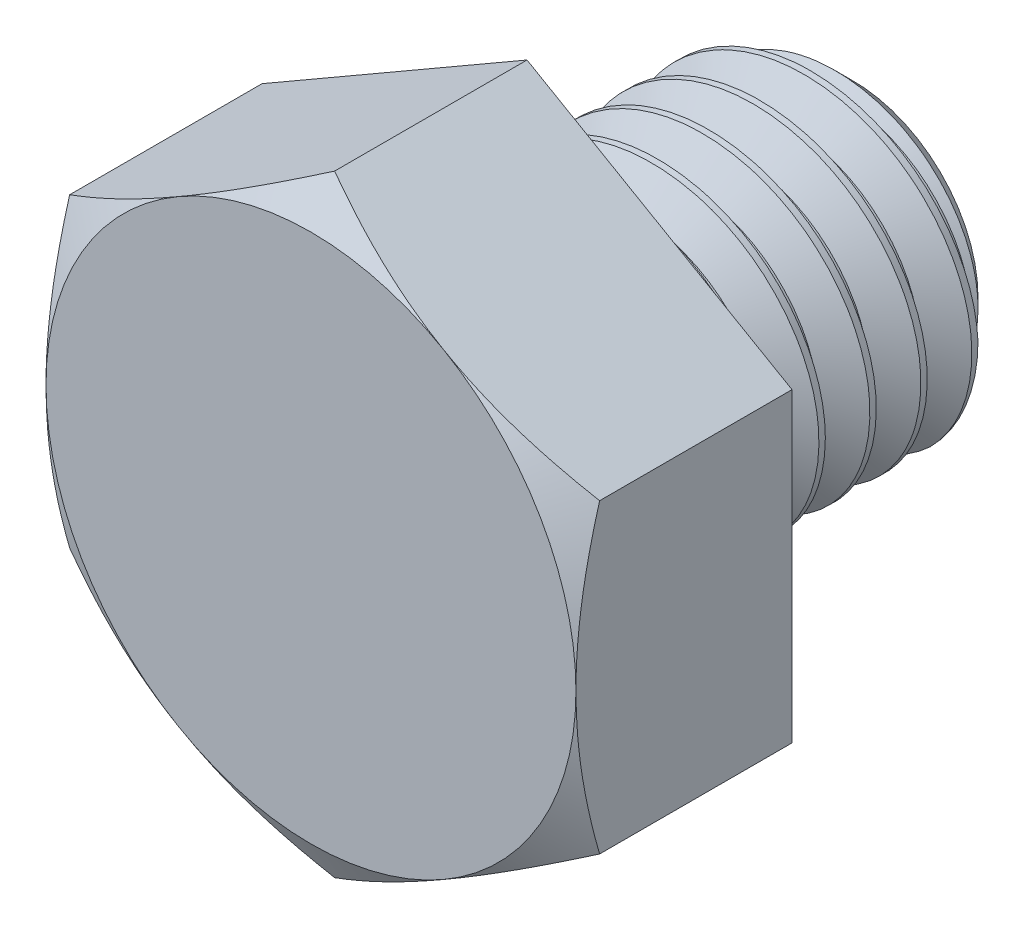
from build123d import *

# Parameters (mm, degrees)
BOSS_EXTRUDE1_DEPTH = 5.3
SKETCH4_OUTSIDE_W   = 80.74
SKETCH4_OUTSIDE_H   = 82.752
SKETCH4_OUTSIDE_R   = 6.5
CUT_EXTRUDE1_DEPTH  = 17.597389353
CUT_EXTRUDE1_DRAFT  = -60
CUT_SWEEP1_PITCH    = 1.25
CUT_SWEEP1_TO       = 8
SKETCH8_R           = 4
BOSS_EXTRUDE2_DEPTH = 8
BOSS_EXTRUDE2_TAPER = 20


with BuildPart() as part:
    # Sketch2 → Revolve1 (revolve)
    with BuildSketch(Plane(origin=(0, 0, 0), x_dir=(0, 0, -1), z_dir=(1, 0, 0)), mode=Mode.PRIVATE) as revolve1_sk:
        Polygon((-6.65, 6.5), (-6.65, 0), (6.65, 0), (6.65, 3.0625), (5.7125, 4), (-1.35, 4), (-1.35, 6.5), align=None)
    revolve(revolve1_sk.sketch.rotate(Axis((0, 0, 6.65), (0, 0, -1)), 90), axis=Axis((0, 0, 6.65), (0, 0, -1)))

    # Sketch3 → Boss-Extrude1 (add)
    with BuildSketch(Plane.XY.offset(6.65)):
        Polygon((0, 7.505553499), (-6.5, 3.75277675), (-6.5, -3.75277675), (0, -7.505553499), (6.5, -3.75277675), (6.5, 3.75277675), align=None)
    extrude(amount=-BOSS_EXTRUDE1_DEPTH)


with BuildPart() as cut_extrude1_tool:
    # Sketch4 outside → Cut-Extrude1 (with draft: the straight prism first)
    with BuildSketch(Plane.XY.offset(6.65)):
        Rectangle(SKETCH4_OUTSIDE_W, SKETCH4_OUTSIDE_H)
        Circle(SKETCH4_OUTSIDE_R, mode=Mode.SUBTRACT)
    extrude(amount=-CUT_EXTRUDE1_DEPTH)
    # Cut-Extrude1: the draft: its side faces are tilted about the plane it starts from
    cut_extrude1_sides = [cut_extrude1_tool.faces().sort_by_distance(p)[0] for p in [
        (0, -41.376, -2.148694676),
        (40.37, 0, -2.148694676),
        (0, 41.376, -2.148694676),
        (-40.37, 0, -2.148694676),
        (-6.5, 0, -2.148694676),
    ]]
    draft(cut_extrude1_sides, Plane.XY.offset(6.65), CUT_EXTRUDE1_DRAFT)


with BuildPart() as part_1:
    add(part.part)

    # Cut-Extrude1: cut by cut_extrude1_tool
    add(cut_extrude1_tool.part, mode=Mode.SUBTRACT)


with BuildPart() as body_2:
    # Split1: read off the stored shape, not the designer's step
    # Split1: the piece on the far side of the plane
    add(part_1.part)
    split(bisect_by=Plane.XY.offset(1.35), keep=Keep.BOTTOM)

    # Cut-Sweep1: arcs per turn and ends read off the stored shape
    # Cut-Sweep1: the profile of Sketch7 screwed along a right-hand helix through 7.4 turns, 8 arcs to a turn; built about Z, then put on its axis
    cut_sweep1_z = Axis((0, 0, 0), (0, 0, 1))
    cut_sweep1_corners = [(4.067658235, 0, 0.0390625), (3.188101184, 0, -0.46875), (3.188101184, 0, -0.625), (4.067658235, 0, -1.1328125)]
    with BuildLine(mode=Mode.PRIVATE) as cut_sweep1_profile:
        Line(cut_sweep1_corners[0], cut_sweep1_corners[1])
        Line(cut_sweep1_corners[1], cut_sweep1_corners[2])
        Line(cut_sweep1_corners[2], cut_sweep1_corners[3])
        Line(cut_sweep1_corners[3], cut_sweep1_corners[0])
    cut_sweep1_cap = Face(cut_sweep1_profile.wire())
    cut_sweep1_turn_angles = [0, 22.5, 45, 67.5, 90, 112.5, 135, 157.5, 180, 202.5, 225, 247.5, 270, 292.5, 315, 337.5, 360]
    cut_sweep1_turn_weights = [1, 0.9238795325112867, 1, 0.9238795325112867, 1, 0.9238795325112867, 1, 0.9238795325112867, 1, 0.9238795325112867, 1, 0.9238795325112867, 1, 0.9238795325112867, 1, 0.9238795325112867, 1]
    cut_sweep1_turn_rails = [Edge.make_bspline([Vector(p[0], p[1], 0).rotate(cut_sweep1_z, cut_sweep1_turn_angles[k]) / cut_sweep1_turn_weights[k] + Vector(0, 0, p[2] + CUT_SWEEP1_PITCH * cut_sweep1_turn_angles[k] / 360) for k in range(17)], [0, 0, 0, 1, 1, 2, 2, 3, 3, 4, 4, 5, 5, 6, 6, 7, 7, 8, 8, 8], 2, cut_sweep1_turn_weights) for p in cut_sweep1_corners]
    cut_sweep1_turn_sides = [Face.make_surface_from_curves(cut_sweep1_turn_rails[p[0]], cut_sweep1_turn_rails[p[1]]) for p in [(0, 1), (1, 2), (2, 3), (3, 0)]]
    cut_sweep1_last_angles = [2520, 2542.5, 2565, 2587.5, 2610, 2632.5, 2655, 2659.5, 2664]
    cut_sweep1_last_weights = [1, 0.9238795325112867, 1, 0.9238795325112867, 1, 0.9238795325112867, 1, 0.9969173337331242, 1]
    cut_sweep1_last_rails = [Edge.make_bspline([Vector(p[0], p[1], 0).rotate(cut_sweep1_z, cut_sweep1_last_angles[k]) / cut_sweep1_last_weights[k] + Vector(0, 0, p[2] + CUT_SWEEP1_PITCH * cut_sweep1_last_angles[k] / 360) for k in range(9)], [0, 0, 0, 1, 1, 2, 2, 3, 3, 4, 4, 4], 2, cut_sweep1_last_weights) for p in cut_sweep1_corners]
    cut_sweep1_last_sides = [Face.make_surface_from_curves(cut_sweep1_last_rails[p[0]], cut_sweep1_last_rails[p[1]]) for p in [(0, 1), (1, 2), (2, 3), (3, 0)]]
    cut_sweep1 = Plane(origin=(0, 0, -6.65), x_dir=(0, 1, 0), z_dir=(0, 0, 1)) * split(Solid(Shell([*[p.moved(Location((0, 0, CUT_SWEEP1_PITCH * i))) for i in range(7) for p in cut_sweep1_turn_sides], *cut_sweep1_last_sides, cut_sweep1_cap, cut_sweep1_cap.rotate(cut_sweep1_z, 2664).moved(Location((0, 0, CUT_SWEEP1_PITCH * 2664 / 360)))])), bisect_by=Plane.XY.offset(CUT_SWEEP1_TO), keep=Keep.BOTTOM, mode=Mode.PRIVATE)
    add(cut_sweep1, mode=Mode.SUBTRACT)


with BuildPart() as part_2:
    add(part_1.part)

    # Split1
    split(bisect_by=Plane.XY.offset(1.35), keep=Keep.TOP)

    add(body_2.part)  # Boss-Extrude2 merges body 2
    # Sketch8 → Boss-Extrude2 (add)
    with BuildSketch(Plane(origin=(0, 0, 1.35), x_dir=(-1, 0, 0), z_dir=(0, 0, -1))):
        Circle(SKETCH8_R)
    extrude(amount=BOSS_EXTRUDE2_DEPTH, taper=BOSS_EXTRUDE2_TAPER)


solid = part_2.part
